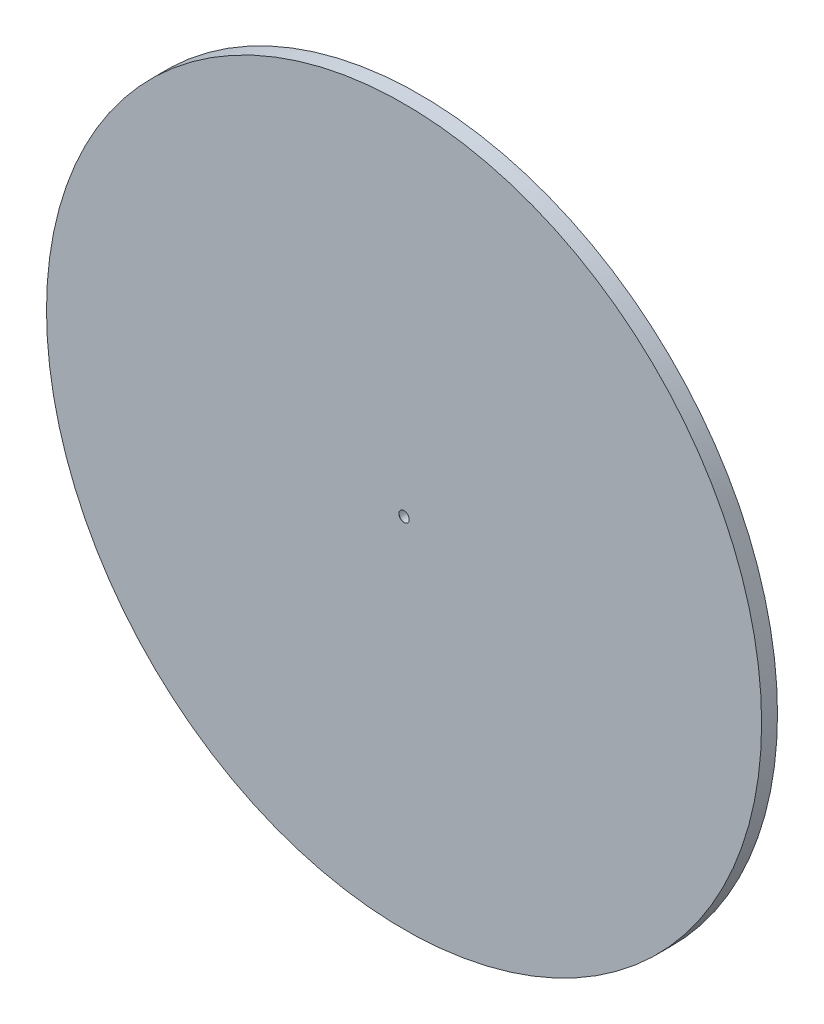
from build123d import *

# Parameters (mm, degrees)
SKETCH1_R           = 45
BOSS_EXTRUDE1_DEPTH = 2


# Read off the part's stored shape, not the designer's step: Cavity1
with BuildPart() as part:
    # Sketch1 → Boss-Extrude1 (new body)
    with BuildSketch(Plane.XY):
        Circle(SKETCH1_R)
    extrude(amount=BOSS_EXTRUDE1_DEPTH)

    # Cavity1 outline → Cavity1 (revolve, cut)
    with BuildSketch(Plane.XZ):
        Polygon((0.75, 0), (0.75, 1.9), (0.65, 2), (0, 2), (0, 0), align=None)
    revolve(axis=Axis((0, 0, 0), (0, 0, 1)), mode=Mode.SUBTRACT)


solid = part.part
